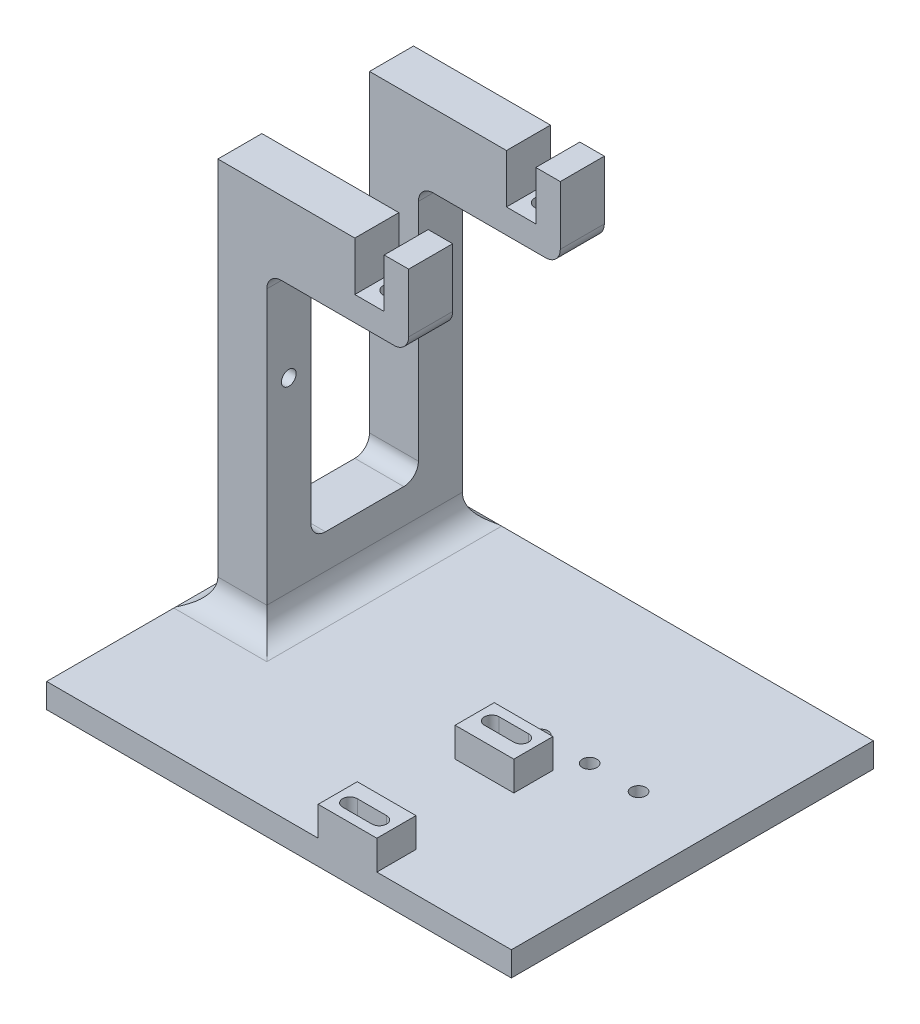
from build123d import *
from build123d.topology import SkipClean

# Parameters (mm, degrees)
BOSS_EXTRUDE1_DEPTH      = 40
SKETCH2_W                = 22
SKETCH2_H                = 67
CUT_EXTRUDE1_DEPTH       = 101.881118154
CUT_EXTRUDE2_REACH       = 90.781
SKETCH4_R                = 1.7
FILLET1_R                = 3
FILLET2_R                = 3
BOSS_EXTRUDE2_DEPTH      = 81
BOSS_EXTRUDE2_DEPTH_BACK = 14
SKETCH10_W               = 74
SKETCH10_H               = 5
CUT_EXTRUDE6_REACH       = 141.868
BOSS_EXTRUDE3_START      = 6
SKETCH14_W               = 12
SKETCH14_H               = 8
BOSS_EXTRUDE3_DEPTH      = 6
FILLET3_START            = -4.000007467
FILLET3_DEPTH            = 19.000007567
FILLET3_START_2          = -3.000020216
FILLET3_2_DEPTH          = 49.000020216
FILLET3_3_DEPTH          = 40
SKETCH15_R               = 1.5
CUT_EXTRUDE8_DEPTH       = 140.867794721
SKETCH16_R               = 1.5
CUT_EXTRUDE9_DEPTH       = 137.594289778


with BuildPart() as part:
    # Sketch1 → Boss-Extrude1 (new body)
    with BuildSketch(Plane.XY):
        Polygon((0, 84), (28, 84), (28, 74), (34, 74), (34, 84), (39, 84), (39, 69), (10, 69), (10, 5), (0, 5), align=None)
    extrude(amount=BOSS_EXTRUDE1_DEPTH)

    # Sketch2 → Cut-Extrude1 (cut, through all)
    with BuildSketch(Plane.ZY):
        with Locations((20, 50.5)):
            Rectangle(SKETCH2_W, SKETCH2_H)
    extrude(amount=-CUT_EXTRUDE1_DEPTH, mode=Mode.SUBTRACT)

    # Sketch4 → Cut-Extrude2 (cut, up to next)
    with BuildSketch(Plane(origin=(0, 74, 0), x_dir=(1, 0, 0), z_dir=(0, 1, 0)), mode=Mode.PRIVATE) as cut_extrude2_sk1:
        with Locations(Location((31, -35.5, 0), (0, 0, 270))):
            Circle(SKETCH4_R)
    cut_extrude2_tool1 = extrude(cut_extrude2_sk1.sketch, amount=-CUT_EXTRUDE2_REACH, mode=Mode.PRIVATE) & part.part
    # Sketch4 → Cut-Extrude2 (cut, up to next)
    with BuildSketch(Plane(origin=(0, 74, 0), x_dir=(1, 0, 0), z_dir=(0, 1, 0)), mode=Mode.PRIVATE) as cut_extrude2_sk2:
        with Locations(Location((31, -4.5, 0), (0, 0, 270))):
            Circle(SKETCH4_R)
    cut_extrude2_tool2 = extrude(cut_extrude2_sk2.sketch, amount=-CUT_EXTRUDE2_REACH, mode=Mode.PRIVATE) & part.part
    add(cut_extrude2_tool1.solids().sort_by_distance((31, 74, 35.5))[0], mode=Mode.SUBTRACT)
    add(cut_extrude2_tool2.solids().sort_by_distance((31, 74, 4.5))[0], mode=Mode.SUBTRACT)

    # Fillet1
    fillet1_edges = [part.edges().sort_by_distance(p)[0] for p in [
        (5, 17, 31),
        (5, 17, 9),
    ]]
    fillet(fillet1_edges, radius=FILLET1_R)

    # Fillet2
    fillet2_edges = [part.edges().sort_by_distance(p)[0] for p in [
        (39, 69, 35.5),
        (10, 69, 35.5),
        (39, 69, 4.5),
        (10, 69, 4.5),
    ]]
    fillet(fillet2_edges, radius=FILLET2_R)

    # Sketch10 → Boss-Extrude2 (add, two sides: drawn at the far end of the back side and taken through both)
    with BuildSketch(Plane(origin=(10, 0, 0), x_dir=(0, 0, -1), z_dir=(1, 0, 0)).offset(-BOSS_EXTRUDE2_DEPTH_BACK)):
        with Locations((-34, 2.5)):
            Rectangle(SKETCH10_W, SKETCH10_H)
    extrude(amount=BOSS_EXTRUDE2_DEPTH + BOSS_EXTRUDE2_DEPTH_BACK)

    # Sketch13 → Cut-Extrude6 (cut, up to next)
    with BuildSketch(Plane(origin=(0, 5, 0), x_dir=(1, 0, 0), z_dir=(0, 1, 0)), mode=Mode.PRIVATE) as cut_extrude6_sk1:
        with BuildLine():
            Line((54.5, -66), (60.5, -66))
            ThreePointArc((60.5, -66), (62, -67.5), (60.5, -69))
            Line((60.5, -69), (54.5, -69))
            ThreePointArc((54.5, -69), (53, -67.5), (54.5, -66))
        make_face()
    cut_extrude6_tool1 = extrude(cut_extrude6_sk1.sketch, amount=-CUT_EXTRUDE6_REACH, mode=Mode.PRIVATE) & part.part
    # Sketch13 → Cut-Extrude6 (cut, up to next)
    with BuildSketch(Plane(origin=(0, 5, 0), x_dir=(1, 0, 0), z_dir=(0, 1, 0)), mode=Mode.PRIVATE) as cut_extrude6_sk2:
        with BuildLine():
            Line((54.5, -37), (60.5, -37))
            ThreePointArc((60.5, -37), (62, -38.5), (60.5, -40))
            Line((60.5, -40), (54.5, -40))
            ThreePointArc((54.5, -40), (53, -38.5), (54.5, -37))
        make_face()
    cut_extrude6_tool2 = extrude(cut_extrude6_sk2.sketch, amount=-CUT_EXTRUDE6_REACH, mode=Mode.PRIVATE) & part.part
    add(cut_extrude6_tool1.solids().sort_by_distance((57.5, 5, 67.5))[0], mode=Mode.SUBTRACT)
    add(cut_extrude6_tool2.solids().sort_by_distance((57.5, 5, 38.5))[0], mode=Mode.SUBTRACT)

    # Sketch14 → Boss-Extrude3 (add)
    # profile 1 of 2: a face of its own
    with BuildSketch(Plane(origin=(0, 5, 0), x_dir=(1, 0, 0), z_dir=(0, 1, 0)).offset(BOSS_EXTRUDE3_START)):
        with Locations((57.5, -67)):
            Rectangle(SKETCH14_W, SKETCH14_H)
        with BuildLine():
            Line((60.5, -66), (54.5, -66))
            ThreePointArc((54.5, -66), (53, -67.5), (54.5, -69))
            Line((54.5, -69), (60.5, -69))
            ThreePointArc((60.5, -69), (62, -67.5), (60.5, -66))
        make_face(mode=Mode.SUBTRACT)
    # profile 2 of 2: a face of its own
    with BuildSketch(Plane(origin=(0, 5, 0), x_dir=(1, 0, 0), z_dir=(0, 1, 0)).offset(BOSS_EXTRUDE3_START)):
        with Locations((57.5, -39)):
            Rectangle(SKETCH14_W, SKETCH14_H)
        with BuildLine():
            Line((60.5, -37), (54.5, -37))
            ThreePointArc((54.5, -37), (53, -38.5), (54.5, -40))
            Line((54.5, -40), (60.5, -40))
            ThreePointArc((60.5, -40), (62, -38.5), (60.5, -37))
        make_face(mode=Mode.SUBTRACT)
    extrude(amount=-BOSS_EXTRUDE3_DEPTH)

    # Fillet3: read off the stored shape, not the designer's step
    # Fillet3 outline → Fillet3 (add)
    with BuildSketch(Plane.YZ.offset(FILLET3_START)):
        with BuildLine():
            Line((9.582575695, 0), (5, 0))
            Line((5, 0), (4.99997988, -3.0000461))
            ThreePointArc((4.99997988, -3.0000461), (6.843941866, -0.816713642), (9.582575695, 0))
        make_face()
        with BuildLine():
            ThreePointArc((10, 40), (6.464466094, 41.464466094), (5, 45))
            Line((5, 45), (5, 40))
            Line((5, 40), (10, 40))
        make_face()
    extrude(amount=FILLET3_DEPTH)

    # Fillet3 2 outline → Fillet3 2 (cut)
    with BuildSketch(Plane.XY.offset(FILLET3_START_2)):
        with BuildLine():
            ThreePointArc((-4.000007348, 4.9999985), (-1.127019025, 6.736698921), (0, 9.898979486))
            Line((0, 9.898979486), (0, 12))
            Line((0, 12), (-4.000007467, 12))
            Line((-4.000007467, 12), (-4.000007467, 10))
            Line((-4.000007467, 10), (-4.000007467, 9.582575695))
            Line((-4.000007467, 9.582575695), (-4.000007348, 4.9999985))
        make_face()
        with BuildLine():
            Line((15.0000001, 12), (10, 12))
            Line((10, 12), (10, 10))
            ThreePointArc((10, 10), (11.464466094, 6.464466094), (15, 5))
            Line((15, 5), (15.0000001, 9.582575695))
            Line((15.0000001, 9.582575695), (15.0000001, 10))
            Line((15.0000001, 10), (15.0000001, 12))
        make_face()
    extrude(amount=FILLET3_2_DEPTH, mode=Mode.SUBTRACT)

    # Fillet3 3 outline → Fillet3 3 (add)
    with SkipClean():  # the faces are left unmerged after this step: merging them gives an invalid solid
        with BuildSketch(Plane.XY):
            with BuildLine():
                Line((0, 12), (0, 9.898979486))
                ThreePointArc((0, 9.898979486), (-1.127019025, 6.736698921), (-4.000007348, 4.9999985))
                Line((-4.000007348, 4.9999985), (15, 5))
                ThreePointArc((15, 5), (11.464466094, 6.464466094), (10, 10))
                Line((10, 10), (10, 12))
                Line((10, 12), (0, 12))
            make_face()
        extrude(amount=FILLET3_3_DEPTH)
    add(part.part.scale(1), mode=Mode.REPLACE)  # the faces are merged on a copy

    # Sketch15 → Cut-Extrude8 (cut, through all)
    with SkipClean():  # the faces are left unmerged after this step: merging them gives an invalid solid
        with BuildSketch(Plane(origin=(0, 5, 0), x_dir=(1, 0, 0), z_dir=(0, 1, 0))):
            with Locations(Location((66, -30, 0), (0, 0, 270))):
                Circle(SKETCH15_R)
            with Locations(Location((76, -30, 0), (0, 0, 270))):
                Circle(SKETCH15_R)
            with Locations(Location((56, -30, 0), (0, 0, 270))):
                Circle(SKETCH15_R)
        extrude(amount=-CUT_EXTRUDE8_DEPTH, mode=Mode.SUBTRACT)

    # Sketch16 → Cut-Extrude9 (cut, through all)
    with SkipClean():  # the faces are left unmerged after this step: merging them gives an invalid solid
        with BuildSketch(Plane(origin=(10, 0, 0), x_dir=(0, 0, -1), z_dir=(1, 0, 0))):
            with Locations((-4.5, 48)):
                Circle(SKETCH16_R)
            with Locations((-35.5, 48)):
                Circle(SKETCH16_R)
        extrude(amount=-CUT_EXTRUDE9_DEPTH, mode=Mode.SUBTRACT)


solid = part.part
